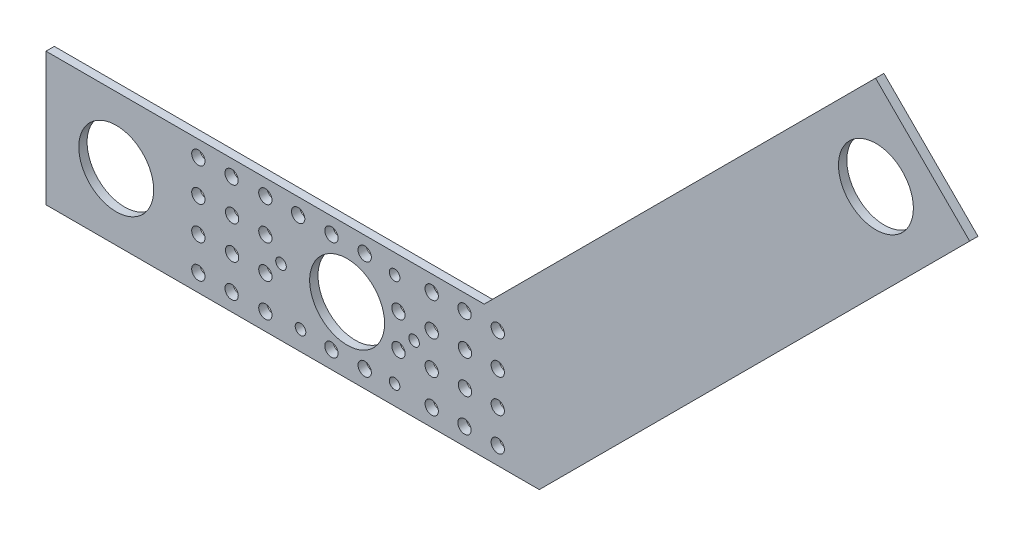
from build123d import *

# Parameters (mm, degrees)
SKETCH1_R           = 2.54
SKETCH1_R_2         = 2.0193
SKETCH1_R_3         = 14.3002
BOSS_EXTRUDE1_DEPTH = 3.175


with BuildPart() as part:
    # Sketch1 → Boss-Extrude1 (new body)
    with BuildSketch(Plane.XY):
        Polygon((-59.693768546, 4.271271353), (-59.693768546, -46.528728647), (128.614138554, -46.528728647), (292.911431822, 117.768564621), (256.990407338, 153.689589105), (107.572089586, 4.271271353), align=None)
        with Locations((24.040159799, -14.512116048)):
            Circle(SKETCH1_R, mode=Mode.SUBTRACT)
        with Locations((74.840159799, -14.512116048)):
            Circle(SKETCH1_R, mode=Mode.SUBTRACT)
        with Locations((87.540159799, -14.512116048)):
            Circle(SKETCH1_R, mode=Mode.SUBTRACT)
        with Locations((100.240159799, -14.512116048)):
            Circle(SKETCH1_R, mode=Mode.SUBTRACT)
        with Locations((100.240159799, -27.212116048)):
            Circle(SKETCH1_R, mode=Mode.SUBTRACT)
        with Locations((87.540159799, -27.212116048)):
            Circle(SKETCH1_R, mode=Mode.SUBTRACT)
        with Locations((74.840159799, -27.212116048)):
            Circle(SKETCH1_R, mode=Mode.SUBTRACT)
        with Locations((24.040159799, -27.212116048)):
            Circle(SKETCH1_R, mode=Mode.SUBTRACT)
        with Locations((11.340159799, -27.212116048)):
            Circle(SKETCH1_R, mode=Mode.SUBTRACT)
        with Locations((11.340159799, -14.512116048)):
            Circle(SKETCH1_R, mode=Mode.SUBTRACT)
        with Locations((11.158871814, -1.812116048)):
            Circle(SKETCH1_R, mode=Mode.SUBTRACT)
        with Locations((24.040159799, -1.812116048)):
            Circle(SKETCH1_R, mode=Mode.SUBTRACT)
        with Locations((36.558871814, -1.812116048)):
            Circle(SKETCH1_R, mode=Mode.SUBTRACT)
        with Locations((49.258871814, -1.812116048)):
            Circle(SKETCH1_R, mode=Mode.SUBTRACT)
        with Locations((61.958871814, -1.812116048)):
            Circle(SKETCH1_R, mode=Mode.SUBTRACT)
        with Locations((87.540159799, -1.812116048)):
            Circle(SKETCH1_R, mode=Mode.SUBTRACT)
        with Locations((100.058871814, -1.812116048)):
            Circle(SKETCH1_R, mode=Mode.SUBTRACT)
        with Locations((112.758871814, -1.812116048)):
            Circle(SKETCH1_R, mode=Mode.SUBTRACT)
        with Locations((112.758871814, -14.512116048)):
            Circle(SKETCH1_R, mode=Mode.SUBTRACT)
        with Locations((112.758871814, -27.212116048)):
            Circle(SKETCH1_R, mode=Mode.SUBTRACT)
        with Locations((112.758871814, -39.912116048)):
            Circle(SKETCH1_R, mode=Mode.SUBTRACT)
        with Locations((100.058871814, -39.912116048)):
            Circle(SKETCH1_R, mode=Mode.SUBTRACT)
        with Locations((87.540159799, -39.912116048)):
            Circle(SKETCH1_R, mode=Mode.SUBTRACT)
        with Locations((61.958871814, -39.912116048)):
            Circle(SKETCH1_R, mode=Mode.SUBTRACT)
        with Locations((49.258871814, -39.912116048)):
            Circle(SKETCH1_R, mode=Mode.SUBTRACT)
        with Locations((24.040159799, -39.912116048)):
            Circle(SKETCH1_R, mode=Mode.SUBTRACT)
        with Locations((11.158871814, -39.912116048)):
            Circle(SKETCH1_R, mode=Mode.SUBTRACT)
        with Locations((-1.541128186, -39.912116048)):
            Circle(SKETCH1_R, mode=Mode.SUBTRACT)
        with Locations((-1.541128186, -27.212116048)):
            Circle(SKETCH1_R, mode=Mode.SUBTRACT)
        with Locations((-1.541128186, -14.512116048)):
            Circle(SKETCH1_R, mode=Mode.SUBTRACT)
        with Locations((-1.541128186, -1.812116048)):
            Circle(SKETCH1_R, mode=Mode.SUBTRACT)
        with Locations((73.378301019, -3.178216405)):
            Circle(SKETCH1_R_2, mode=Mode.SUBTRACT)
        with Locations((80.817788776, -21.138728647)):
            Circle(SKETCH1_R_2, mode=Mode.SUBTRACT)
        with Locations((73.378301019, -39.099240889)):
            Circle(SKETCH1_R_2, mode=Mode.SUBTRACT)
        with Locations((37.457276534, -39.099240889)):
            Circle(SKETCH1_R_2, mode=Mode.SUBTRACT)
        with Locations((30.017788776, -21.138728647)):
            Circle(SKETCH1_R_2, mode=Mode.SUBTRACT)
        with Locations((55.2538213, -21.128728647)):
            Circle(SKETCH1_R_3, mode=Mode.SUBTRACT)
        with Locations((-32.8841787, -21.128728647)):
            Circle(SKETCH1_R_3, mode=Mode.SUBTRACT)
        with Locations((257.120708411, 117.898865694)):
            Circle(SKETCH1_R_3, mode=Mode.SUBTRACT)
    extrude(amount=BOSS_EXTRUDE1_DEPTH)


solid = part.part
